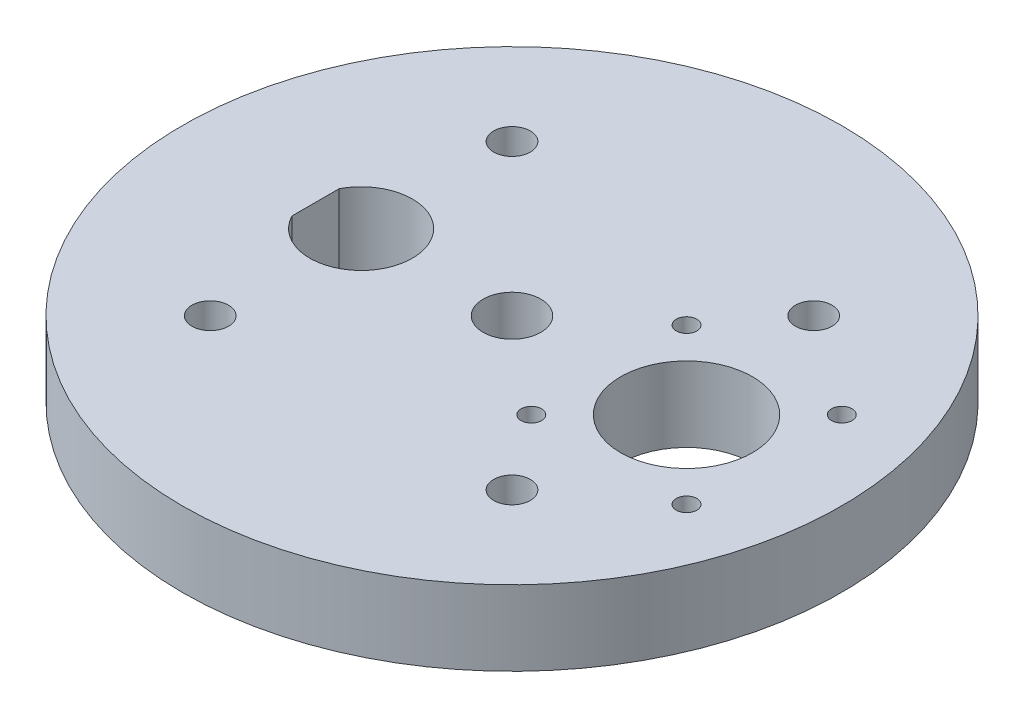
from build123d import *

# Parameters (mm, degrees)
SKETCH2_R           = 57.15
BOSS_EXTRUDE1_DEPTH = 13
CUT_EXTRUDE1_REACH  = 83.861
SKETCH6_R           = 3.175
SKETCH7_R           = 11.43
SKETCH7_R_2         = 1.778
CUT_EXTRUDE2_DEPTH  = 82.861132413
SKETCH8_R           = 5
CUT_EXTRUDE3_DEPTH  = 82.861132413


with BuildPart() as part:
    # Sketch2 → Boss-Extrude1 (new body)
    with BuildSketch(Plane(origin=(0, 0, 0), x_dir=(1, 0, 0), z_dir=(0, 1, 0))):
        Circle(SKETCH2_R)
    extrude(amount=BOSS_EXTRUDE1_DEPTH)

    # Sketch6 → Cut-Extrude1 (cut, up to next)
    with BuildSketch(Plane(origin=(0, 13, 0), x_dir=(1, 0, 0), z_dir=(0, 1, 0)), mode=Mode.PRIVATE) as cut_extrude1_sk1:
        with Locations((-26.1629, -26.1629)):
            Circle(SKETCH6_R)
    cut_extrude1_tool1 = extrude(cut_extrude1_sk1.sketch, amount=-CUT_EXTRUDE1_REACH, mode=Mode.PRIVATE) & part.part
    # Sketch6 → Cut-Extrude1 (cut, up to next)
    with BuildSketch(Plane(origin=(0, 13, 0), x_dir=(1, 0, 0), z_dir=(0, 1, 0)), mode=Mode.PRIVATE) as cut_extrude1_sk2:
        with Locations((26.1629, -26.1629)):
            Circle(SKETCH6_R)
    cut_extrude1_tool2 = extrude(cut_extrude1_sk2.sketch, amount=-CUT_EXTRUDE1_REACH, mode=Mode.PRIVATE) & part.part
    # Sketch6 → Cut-Extrude1 (cut, up to next)
    with BuildSketch(Plane(origin=(0, 13, 0), x_dir=(1, 0, 0), z_dir=(0, 1, 0)), mode=Mode.PRIVATE) as cut_extrude1_sk3:
        with Locations((-26.1629, 26.163103615)):
            Circle(SKETCH6_R)
    cut_extrude1_tool3 = extrude(cut_extrude1_sk3.sketch, amount=-CUT_EXTRUDE1_REACH, mode=Mode.PRIVATE) & part.part
    # Sketch6 → Cut-Extrude1 (cut, up to next)
    with BuildSketch(Plane(origin=(0, 13, 0), x_dir=(1, 0, 0), z_dir=(0, 1, 0)), mode=Mode.PRIVATE) as cut_extrude1_sk4:
        with Locations((26.1629, 26.163103615)):
            Circle(SKETCH6_R)
    cut_extrude1_tool4 = extrude(cut_extrude1_sk4.sketch, amount=-CUT_EXTRUDE1_REACH, mode=Mode.PRIVATE) & part.part
    add(cut_extrude1_tool1.solids().sort_by_distance((-26.1629, 13, 26.1629))[0], mode=Mode.SUBTRACT)
    add(cut_extrude1_tool2.solids().sort_by_distance((26.1629, 13, 26.1629))[0], mode=Mode.SUBTRACT)
    add(cut_extrude1_tool3.solids().sort_by_distance((-26.1629, 13, -26.163104))[0], mode=Mode.SUBTRACT)
    add(cut_extrude1_tool4.solids().sort_by_distance((26.1629, 13, -26.163104))[0], mode=Mode.SUBTRACT)

    # Sketch7 → Cut-Extrude2 (cut, through all)
    with BuildSketch(Plane(origin=(0, 13, 0), x_dir=(1, 0, 0), z_dir=(0, 1, 0))):
        with Locations((30, 0.269903496)):
            Circle(SKETCH7_R)
        with Locations((16.54, -13.194096504)):
            Circle(SKETCH7_R_2)
        with Locations((16.54, 13.729903496)):
            Circle(SKETCH7_R_2)
        with Locations((43.46, 13.729903496)):
            Circle(SKETCH7_R_2)
        with Locations((43.46, -13.194096504)):
            Circle(SKETCH7_R_2)
    extrude(amount=-CUT_EXTRUDE2_DEPTH, mode=Mode.SUBTRACT)

    # Sketch8 → Cut-Extrude3 (cut, through all)
    with BuildSketch(Plane(origin=(0, 13, 0), x_dir=(1, 0, 0), z_dir=(0, 1, 0))):
        Circle(SKETCH8_R)
        with BuildLine():
            Line((-34.0629, 4.098780306), (-34.0629, -4.098780306))
            ThreePointArc((-34.0629, -4.098780306), (-17.2629, 0), (-34.0629, 4.098780306))
        make_face()
    extrude(amount=-CUT_EXTRUDE3_DEPTH, mode=Mode.SUBTRACT)


solid = part.part
